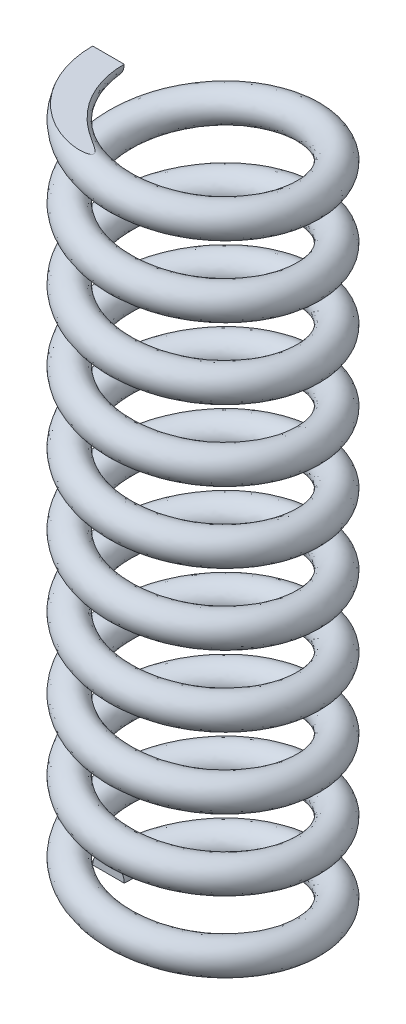
from build123d import *

# Parameters (mm, degrees)
SWEEP1_PITCH            = 1.8
SWEEP1_HEIGHT           = 18
SWEEP1_RADIUS           = 2.4
SWEEP1_START_ANGLE      = -90
SKETCH2_R               = 0.4
CUT_EXTRUDE1_DEPTH      = 19.821269179
CUT_EXTRUDE1_DEPTH_BACK = 19.821269179
SKETCH3_OUTSIDE_W       = 11.68
SKETCH3_OUTSIDE_H       = 24.88
SKETCH3_OUTSIDE_W_2     = 10.6
SKETCH3_OUTSIDE_H_2     = 18


with BuildPart() as part:
    # Sweep1: sweep along a helix
    with BuildLine() as sweep1_path:
        add(Helix(SWEEP1_PITCH, SWEEP1_HEIGHT, SWEEP1_RADIUS, center=(0, 0, 0), direction=(0, 1, 0), lefthand=True, mode=Mode.PRIVATE).rotate(Axis((0, 0, 0), (0, 1, 0)), SWEEP1_START_ANGLE))
    # Sketch2 → Sweep1 (sweep)
    with BuildSketch(Plane.XY):
        with Locations((-2.4, 0)):
            Circle(SKETCH2_R)
    sweep(path=sweep1_path.line, is_frenet=True)

    # Sketch3 outside → Cut-Extrude1 (cut, two sides: drawn at the far end of the back side and taken through both)
    with BuildSketch(Plane(origin=(0, 0, 0), x_dir=(0, 0, -1), z_dir=(1, 0, 0)).offset(-CUT_EXTRUDE1_DEPTH_BACK)):
        with Locations((0, 9)):
            Rectangle(SKETCH3_OUTSIDE_W, SKETCH3_OUTSIDE_H)
        with Locations((0, 9)):
            Rectangle(SKETCH3_OUTSIDE_W_2, SKETCH3_OUTSIDE_H_2, mode=Mode.SUBTRACT)
    extrude(amount=CUT_EXTRUDE1_DEPTH + CUT_EXTRUDE1_DEPTH_BACK, mode=Mode.SUBTRACT)


solid = part.part
